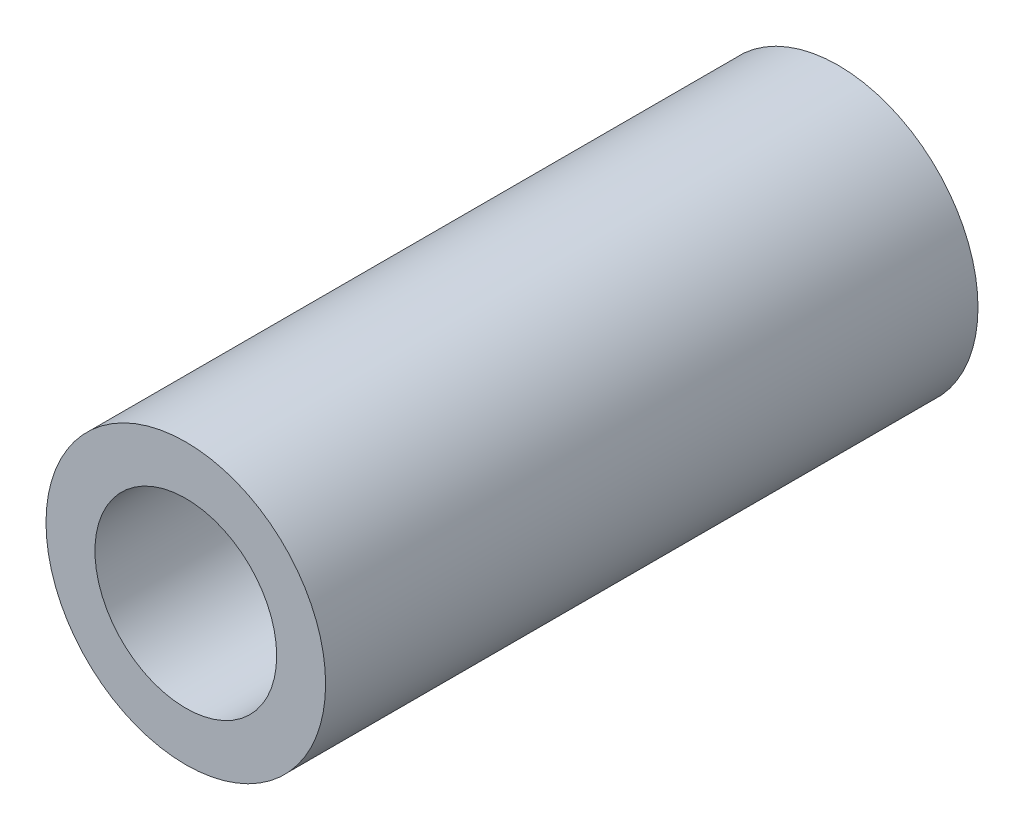
from build123d import *

# Parameters (mm, degrees)
ESQUISSE1_R             = 7.5
BOSS_EXTRU_1_DEPTH      = 35
ESQUISSE2_R             = 4.875
ENL_V_MAT_EXTRU_1_DEPTH = 16
ESQUISSE3_R             = 4.025
ENL_V_MAT_EXTRU_2_DEPTH = 16
BOSS_EXTRU_3_START      = 9
BOSS_EXTRU_3_DEPTH      = 9


with BuildPart() as part:
    # Esquisse1 → Boss.-Extru.1 (new body)
    with BuildSketch(Plane(origin=(0, 0, 0), x_dir=(0, 1, 0), z_dir=(0, 0, 1))):
        Circle(ESQUISSE1_R)
    extrude(amount=BOSS_EXTRU_1_DEPTH)

    # Esquisse2 → Enlèv. mat.-Extru.1 (cut)
    with BuildSketch(Plane.XY.offset(35)):
        Circle(ESQUISSE2_R)
    extrude(amount=-ENL_V_MAT_EXTRU_1_DEPTH, mode=Mode.SUBTRACT)

    # Esquisse3 → Enlèv. mat.-Extru.2 (cut)
    with BuildSketch(Plane(origin=(0, 0, 0), x_dir=(1, 0, 0), z_dir=(0, 0, -1))):
        Circle(ESQUISSE3_R)
    extrude(amount=-ENL_V_MAT_EXTRU_2_DEPTH, mode=Mode.SUBTRACT)

    # Esquisse5 → Boss.-Extru.3 (add)
    with BuildSketch(Plane(origin=(0, 0, 16), x_dir=(1, 0, 0), z_dir=(0, 0, -1)).offset(BOSS_EXTRU_3_START)):
        with BuildLine():
            Line((-2.804621751, 2.886991831), (3.153070081, 2.501754197))
            ThreePointArc((3.153070081, 2.501754197), (0.259723061, 4.016611623), (-2.804621751, 2.886991831))
        make_face()
    extrude(amount=-BOSS_EXTRU_3_DEPTH)


solid = part.part
